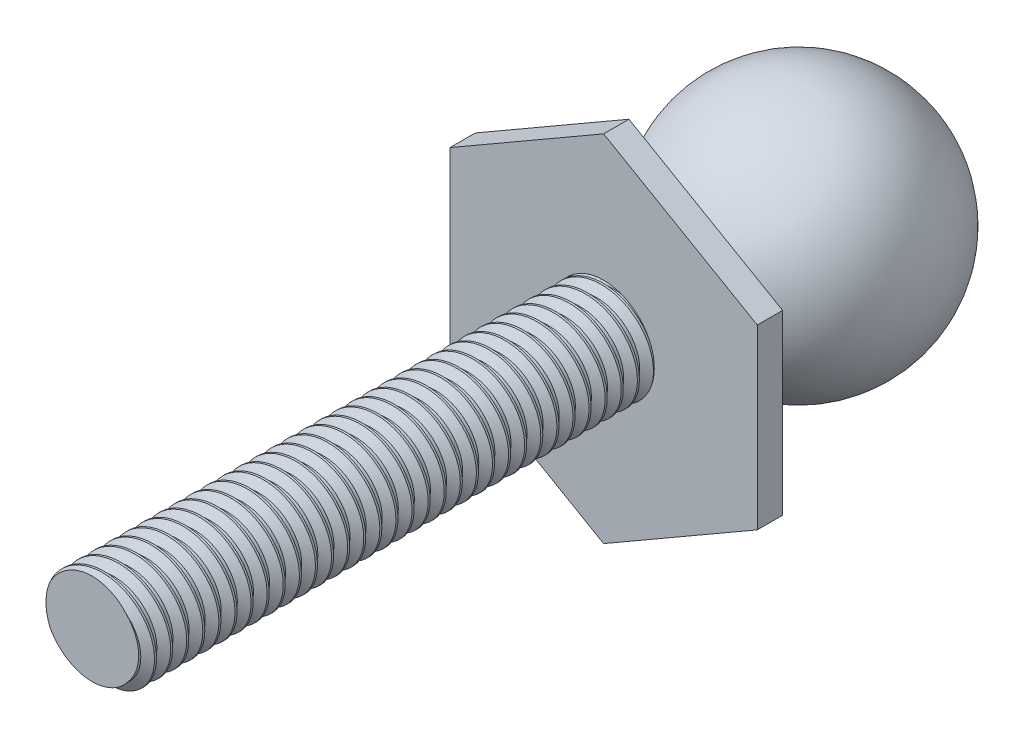
from build123d import *

# Parameters (mm, degrees)
THREAD2_PITCH      = 0.3175
SKETCH8_OUTSIDE_W  = 12.822
SKETCH8_OUTSIDE_H  = 12.822
CUT_EXTRUDE1_DEPTH = 10


with BuildPart() as part:
    # Sketch2 → Revolve2 (revolve)
    with BuildSketch(Plane(origin=(0, 0, 0), x_dir=(1, 0, 0), z_dir=(0, 1, 0))):
        with BuildLine():
            Line((-1, -1.903397663), (-3.5, -1.903397663))
            Line((-3.5, -1.903397663), (-3.5, -2.403397663))
            Line((-3.5, -2.403397663), (-1, -2.403397663))
            Line((-1, -2.403397663), (-1, -12.403397663))
            Line((-1, -12.403397663), (0, -12.403397663))
            Line((0, -12.403397663), (0, 3.946602337))
            ThreePointArc((0, 3.946602337), (-2.422849782, 2.062880629), (-1.194519781, -0.749558516))
            ThreePointArc((-1.194519781, -0.749558516), (-0.816572302, -1.279158419), (-1, -1.903397663))
        make_face()
    revolve(axis=Axis((0, 0, -3.946602337), (0, 0, 1)))

    # Thread2: the profile of Thread Profile2 profile screwed along a right-hand helix of 33.070866 turns, 6 arcs to a turn; built about Z, then put on its axis
    thread2_z = Axis((0, 0, 0), (0, 0, 1))
    thread2_corners = [(1.0003, 0, -0.000173205), (1.0003, 0, 0.277985705), (0.828148085, 0, 0.17859375), (0.828148085, 0, 0.09921875)]
    with BuildLine(mode=Mode.PRIVATE) as thread2_profile:
        Line(thread2_corners[0], thread2_corners[1])
        Line(thread2_corners[1], thread2_corners[2])
        Line(thread2_corners[2], thread2_corners[3])
        Line(thread2_corners[3], thread2_corners[0])
    thread2_cap = Face(thread2_profile.wire())
    thread2_turn_angles = [0, 30, 60, 90, 120, 150, 180, 210, 240, 270, 300, 330, 360]
    thread2_turn_weights = [1, 0.8660254037844387, 1, 0.8660254037844387, 1, 0.8660254037844387, 1, 0.8660254037844387, 1, 0.8660254037844387, 1, 0.8660254037844387, 1]
    thread2_turn_rails = [Edge.make_bspline([Vector(p[0], p[1], 0).rotate(thread2_z, thread2_turn_angles[k]) / thread2_turn_weights[k] + Vector(0, 0, p[2] + THREAD2_PITCH * thread2_turn_angles[k] / 360) for k in range(13)], [0, 0, 0, 1, 1, 2, 2, 3, 3, 4, 4, 5, 5, 6, 6, 6], 2, thread2_turn_weights) for p in thread2_corners]
    thread2_turn_sides = [Face.make_surface_from_curves(thread2_turn_rails[p[0]], thread2_turn_rails[p[1]]) for p in [(0, 1), (1, 2), (2, 3), (3, 0)]]
    thread2_last_angles = [11880, 11892.755905512, 11905.511811024]
    thread2_last_weights = [1, 0.9753195679051633, 1]
    thread2_last_rails = [Edge.make_bspline([Vector(p[0], p[1], 0).rotate(thread2_z, thread2_last_angles[k]) / thread2_last_weights[k] + Vector(0, 0, p[2] + THREAD2_PITCH * thread2_last_angles[k] / 360) for k in range(3)], [0, 0, 0, 1, 1, 1], 2, thread2_last_weights) for p in thread2_corners]
    thread2_last_sides = [Face.make_surface_from_curves(thread2_last_rails[p[0]], thread2_last_rails[p[1]]) for p in [(0, 1), (1, 2), (2, 3), (3, 0)]]
    thread2 = Plane(origin=(0, 0, 2.103397663), x_dir=(1, 0, 0), z_dir=(0, 0, 1)) * Solid(Shell([*[p.moved(Location((0, 0, THREAD2_PITCH * i))) for i in range(33) for p in thread2_turn_sides], *thread2_last_sides, thread2_cap, thread2_cap.rotate(thread2_z, 11905.511811024).moved(Location((0, 0, THREAD2_PITCH * 11905.511811024 / 360)))]))
    add(thread2, mode=Mode.SUBTRACT)

    # Sketch8 outside → Cut-Extrude1 (cut)
    with BuildSketch(Plane(origin=(0, 0, 1.903397663), x_dir=(-1, 0, 0), z_dir=(0, 0, -1))):
        Rectangle(SKETCH8_OUTSIDE_W, SKETCH8_OUTSIDE_H)
        Polygon((0, -3.5), (3.031088913, -1.75), (3.031088913, 1.75), (0, 3.5), (-3.031088913, 1.75), (-3.031088913, -1.75), align=None, mode=Mode.SUBTRACT)
    extrude(amount=-CUT_EXTRUDE1_DEPTH, mode=Mode.SUBTRACT)


solid = part.part
